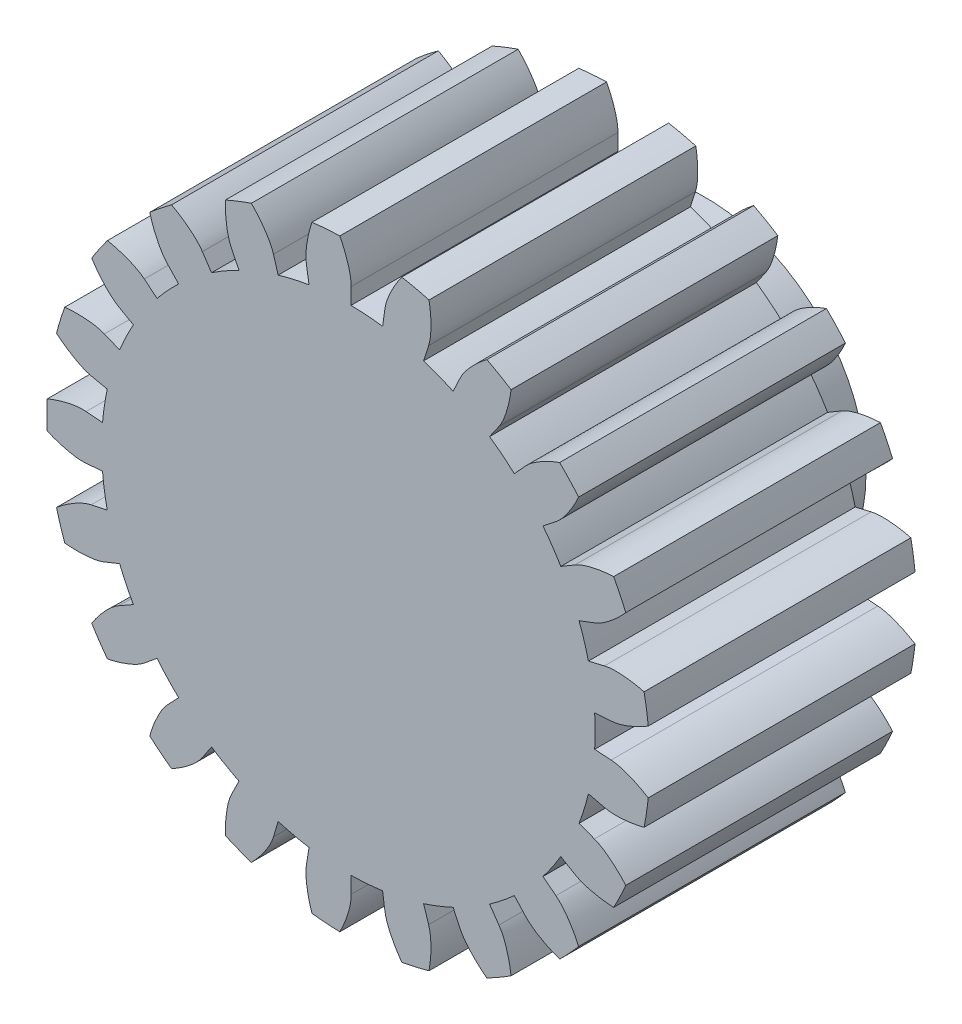
from build123d import *

# Parameters (mm, degrees)
SKETCH_1_R               = 5.75
SKETCH_1_R_2             = 1.475
EXTRUDE_1_DEPTH          = 5
CUT_EXTRUDE_1_DEPTH      = 10.545941546
PATTERN_CIRCULAR_1_DEPTH = 5
SKETCH_2_R               = 1.475
EXTRUDE_2_DEPTH          = 5
SKETCH_3_R               = 3
SKETCH_3_R_2             = 2
SKETCH_3_W               = 2
SKETCH_3_H               = 0.5
SKETCH_3_W_2             = 0.5
SKETCH_3_H_2             = 2
EXTRUDE_3_DEPTH          = 1.7
CUT_EXTRUDE_START        = -1
SKETCH_5_R               = 2
CUT_EXTRUDE_2_DEPTH      = 1
SKETCH_6_OUTSIDE_W       = 16.976
SKETCH_6_OUTSIDE_H       = 17.004
SKETCH_6_OUTSIDE_R       = 5.65
CUT_EXTRUDE_3_DEPTH      = 11.534196955


# Read off the part's stored shape, not the designer's step: 阵列(圆周)1
with BuildPart() as part:
    # 草图1 → 凸台-拉伸1 (new body)
    with BuildSketch(Plane.XY):
        Circle(SKETCH_1_R)
        Circle(SKETCH_1_R_2, mode=Mode.SUBTRACT)
    extrude(amount=EXTRUDE_1_DEPTH)

    # 草图1<3> → 切除-拉伸1 (cut, through all)
    with BuildSketch(Plane.XY):
        with BuildLine():
            Line((4.923195788, 0.316927775), (4.615446536, 0.297116602))
            ThreePointArc((4.615446536, 0.297116602), (4.622611017, 0.148635076), (4.625, 0))
            ThreePointArc((4.625, 0), (4.622611017, -0.148635076), (4.615446536, -0.297116602))
            Line((4.615446536, -0.297116602), (4.923195788, -0.316927775))
            add(Edge.make_bspline(
                [(4.923195788, -0.316927775), (4.960723978, -0.31934363), (5.064950694, -0.333885203), (5.258056408, -0.392528318), (5.454545861, -0.4832362), (5.608701438, -0.573335861), (5.701232058, -0.634072387), (5.713983029, -0.642571358)],
                knots=[0, 0, 0, 0, 0, 0.005604068, 0.015718248, 0.029959916, 0.032248441, 0.032248441, 0.032248441, 0.032248441, 0.032248441], degree=4))
            ThreePointArc((5.713983029, -0.642571358), (5.740988696, -0.321789983), (5.75, 0))
            ThreePointArc((5.75, 0), (5.740988696, 0.321789983), (5.713983029, 0.642571358))
            add(Edge.make_bspline(
                [(4.923195788, 0.316927775), (4.960723978, 0.31934363), (5.064950694, 0.333885203), (5.258056408, 0.392528318), (5.454545861, 0.4832362), (5.608701438, 0.573335861), (5.701232058, 0.634072387), (5.713983029, 0.642571358)],
                knots=[0, 0, 0, 0, 0, 0.005604068, 0.015718248, 0.029959916, 0.032248441, 0.032248441, 0.032248441, 0.032248441, 0.032248441], degree=4))
        make_face()
    extrude(amount=CUT_EXTRUDE_1_DEPTH, mode=Mode.SUBTRACT)

    # 阵列(圆周)1 outline → 阵列(圆周)1 (cut)
    with BuildSketch(Plane.XY):
        with BuildLine():
            Line((4.497971852, 1.076510204), (4.797888114, 1.14828987))
            add(Edge.make_bspline(
                [(4.797888114, 1.14828987), (4.834461118, 1.157042973), (4.938343537, 1.173868805), (5.140155468, 1.174749947), (5.354652063, 1.145988245), (5.528516281, 1.105329614), (5.634838431, 1.07456532), (5.649528027, 1.070202349)],
                knots=[0, 0, 0, 0, 0, 0.005604068, 0.015718248, 0.029959916, 0.032248441, 0.032248441, 0.032248441, 0.032248441, 0.032248441], degree=4))
            ThreePointArc((5.649528027, 1.070202349), (5.494543634, 1.694842253), (5.270725563, 2.298249779))
            add(Edge.make_bspline(
                [(4.611055911, 1.753984996), (4.646204743, 1.76735515), (4.741514754, 1.811972045), (4.908755962, 1.92492872), (5.069779322, 2.069522988), (5.190528858, 2.201057927), (5.261046198, 2.286369979), (5.270725563, 2.298249779)],
                knots=[0, 0, 0, 0, 0, 0.005604068, 0.015718248, 0.029959916, 0.032248441, 0.032248441, 0.032248441, 0.032248441, 0.032248441], degree=4))
            Line((4.611055911, 1.753984996), (4.32281854, 1.644343293))
            ThreePointArc((4.32281854, 1.644343293), (4.419524227, 1.363242682), (4.497971852, 1.076510204))
        make_face()
        with BuildLine():
            add(Edge.make_bspline(
                [(4.611055911, -1.753984996), (4.646204743, -1.76735515), (4.741514754, -1.811972045), (4.908755962, -1.92492872), (5.069779322, -2.069522988), (5.190528858, -2.201057927), (5.261046198, -2.286369979), (5.270725562, -2.298249779)],
                knots=[0, 0, 0, 0, 0, 0.005604068, 0.015718248, 0.029959916, 0.032248441, 0.032248441, 0.032248441, 0.032248441, 0.032248441], degree=4))
            ThreePointArc((5.270725562, -2.298249779), (5.494543634, -1.694842253), (5.649528028, -1.070202349))
            add(Edge.make_bspline(
                [(4.797888114, -1.14828987), (4.834461118, -1.157042973), (4.938343537, -1.173868805), (5.140155468, -1.174749947), (5.354652063, -1.145988245), (5.528516281, -1.105329614), (5.634838431, -1.07456532), (5.649528028, -1.070202349)],
                knots=[0, 0, 0, 0, 0, 0.005604068, 0.015718248, 0.029959916, 0.032248441, 0.032248441, 0.032248441, 0.032248441, 0.032248441], degree=4))
            Line((4.797888114, -1.14828987), (4.497971852, -1.076510204))
            ThreePointArc((4.497971852, -1.076510204), (4.419524227, -1.363242682), (4.32281854, -1.644343293))
            Line((4.32281854, -1.644343293), (4.611055911, -1.753984996))
        make_face()
        with BuildLine():
            add(Edge.make_bspline(
                [(3.889203481, -3.035192954), (3.918849827, -3.058329409), (3.996774421, -3.12905722), (4.123291007, -3.286290758), (4.234540642, -3.471923576), (4.311155011, -3.633206338), (4.353393294, -3.735513566), (4.359141, -3.749718622)],
                knots=[0, 0, 0, 0, 0, 0.005604068, 0.015718248, 0.029959916, 0.032248441, 0.032248441, 0.032248441, 0.032248441, 0.032248441], degree=4))
            ThreePointArc((4.359141, -3.749718622), (4.750872953, -3.239090334), (5.083087669, -2.687883881))
            add(Edge.make_bspline(
                [(4.246267026, -2.511476921), (4.278635171, -2.53062123), (4.372942885, -2.577319418), (4.565529157, -2.637646525), (4.77897393, -2.673386606), (4.957098192, -2.685781701), (5.067764682, -2.687723183), (5.083087669, -2.687883881)],
                knots=[0, 0, 0, 0, 0, 0.005604068, 0.015718248, 0.029959916, 0.032248441, 0.032248441, 0.032248441, 0.032248441, 0.032248441], degree=4))
            Line((4.246267026, -2.511476921), (3.98083263, -2.354484354))
            ThreePointArc((3.98083263, -2.354484354), (3.821354331, -2.605355269), (3.646089147, -2.845462867))
            Line((3.646089147, -2.845462867), (3.889203481, -3.035192954))
        make_face()
        with BuildLine():
            add(Edge.make_bspline(
                [(2.821778254, -4.046710697), (2.843287907, -4.077557678), (2.896903141, -4.168111928), (2.971453551, -4.35565144), (3.023044444, -4.565828519), (3.048716122, -4.742528422), (3.058922292, -4.852740379), (3.060227629, -4.86800851)],
                knots=[0, 0, 0, 0, 0, 0.005604068, 0.015718248, 0.029959916, 0.032248441, 0.032248441, 0.032248441, 0.032248441, 0.032248441], degree=4))
            ThreePointArc((3.060227629, -4.86800851), (3.585066361, -4.495531025), (4.064992664, -4.066735134))
            add(Edge.make_bspline(
                [(3.317346479, -3.651508226), (3.342633714, -3.679342685), (3.418987068, -3.75176389), (3.585235545, -3.866176633), (3.778662992, -3.963242834), (3.945220174, -4.027590298), (4.050397801, -4.062065045), (4.064992664, -4.066735134)],
                knots=[0, 0, 0, 0, 0, 0.005604068, 0.015718248, 0.029959916, 0.032248441, 0.032248441, 0.032248441, 0.032248441, 0.032248441], degree=4))
            Line((3.317346479, -3.651508226), (3.109978959, -3.423252236))
            ThreePointArc((3.109978959, -3.423252236), (2.883640334, -3.615970606), (2.645388733, -3.793750578))
            Line((2.645388733, -3.793750578), (2.821778254, -4.046710697))
        make_face()
        with BuildLine():
            add(Edge.make_bspline(
                [(1.503625646, -4.698660436), (1.515087378, -4.734477054), (1.539629304, -4.836811601), (1.555589407, -5.037993377), (1.54293748, -5.254039561), (1.515385427, -5.430456043), (1.492652621, -5.538779913), (1.489399604, -5.553754479)],
                knots=[0, 0, 0, 0, 0, 0.005604068, 0.015718248, 0.029959916, 0.032248441, 0.032248441, 0.032248441, 0.032248441, 0.032248441], degree=4))
            ThreePointArc((1.489399604, -5.553754479), (2.10071089, -5.352524055), (2.685705221, -5.084239124))
            add(Edge.make_bspline(
                [(2.093665138, -4.467087001), (2.109624581, -4.501138397), (2.161239245, -4.592847677), (2.286378021, -4.751179981), (2.442601265, -4.900947544), (2.58279203, -5.011529822), (2.6731353, -5.075474603), (2.685705221, -5.084239124)],
                knots=[0, 0, 0, 0, 0, 0.005604068, 0.015718248, 0.029959916, 0.032248441, 0.032248441, 0.032248441, 0.032248441, 0.032248441], degree=4))
            Line((2.093665138, -4.467087001), (1.96279001, -4.187849135))
            ThreePointArc((1.96279001, -4.187849135), (1.689702238, -4.305291087), (1.409633921, -4.404946902))
            Line((1.409633921, -4.404946902), (1.503625646, -4.698660436))
        make_face()
        with BuildLine():
            add(Edge.make_bspline(
                [(0.051869301, -4.933113576), (0.052264687, -4.970717367), (0.045552647, -5.075739337), (0.001504318, -5.272687494), (-0.074266251, -5.475406131), (-0.152593914, -5.635863813), (-0.206245786, -5.732674546), (-0.213768111, -5.746024991)],
                knots=[0, 0, 0, 0, 0, 0.005604068, 0.015718248, 0.029959916, 0.032248441, 0.032248441, 0.032248441, 0.032248441, 0.032248441], degree=4))
            ThreePointArc((-0.213768111, -5.746024991), (0.429698038, -5.733921834), (1.067781084, -5.649986156))
            add(Edge.make_bspline(
                [(0.683952463, -4.885745492), (0.689166047, -4.922988208), (0.711455832, -5.025836792), (0.784365777, -5.214020138), (0.889503696, -5.403181558), (0.990871481, -5.550172928), (1.058352997, -5.637905968), (1.067781084, -5.649986156)],
                knots=[0, 0, 0, 0, 0, 0.005604068, 0.015718248, 0.029959916, 0.032248441, 0.032248441, 0.032248441, 0.032248441, 0.032248441], degree=4))
            Line((0.683952463, -4.885745492), (0.641198555, -4.58033726))
            ThreePointArc((0.641198555, -4.58033726), (0.345626683, -4.612067562), (0.048626948, -4.624744363))
            Line((0.048626948, -4.624744363), (0.051869301, -4.933113576))
        make_face()
        with BuildLine():
            add(Edge.make_bspline(
                [(-1.404495859, -4.729237926), (-1.415201951, -4.765287628), (-1.452571563, -4.863665358), (-1.552714436, -5.038880188), (-1.684871098, -5.210258837), (-1.807014616, -5.340500352), (-1.886818351, -5.417195888), (-1.897941592, -5.427735966)],
                knots=[0, 0, 0, 0, 0, 0.005604068, 0.015718248, 0.029959916, 0.032248441, 0.032248441, 0.032248441, 0.032248441, 0.032248441], degree=4))
            ThreePointArc((-1.897941592, -5.427735966), (-1.27949537, -5.605835495), (-0.645020088, -5.713707123))
            add(Edge.make_bspline(
                [(-0.786532391, -4.870284055), (-0.792527914, -4.907408914), (-0.801543555, -5.012258252), (-0.787340809, -5.213571724), (-0.74263018, -5.425319178), (-0.689092349, -5.595658814), (-0.650468614, -5.699384647), (-0.645020088, -5.713707123)],
                knots=[0, 0, 0, 0, 0, 0.005604068, 0.015718248, 0.029959916, 0.032248441, 0.032248441, 0.032248441, 0.032248441, 0.032248441], degree=4))
            Line((-0.786532391, -4.870284055), (-0.737366206, -4.565842319))
            ThreePointArc((-0.737366206, -4.565842319), (-1.02915932, -4.509041594), (-1.316700742, -4.433612991))
            Line((-1.316700742, -4.433612991), (-1.404495859, -4.729237926))
        make_face()
        with BuildLine():
            add(Edge.make_bspline(
                [(-2.736065398, -4.105148733), (-2.756921685, -4.136441171), (-2.821628415, -4.219433368), (-2.968967699, -4.357346265), (-3.145767755, -4.482157182), (-3.300874139, -4.570609997), (-3.399738824, -4.620375602), (-3.413474634, -4.627168781)],
                knots=[0, 0, 0, 0, 0, 0.005604068, 0.015718248, 0.029959916, 0.032248441, 0.032248441, 0.032248441, 0.032248441, 0.032248441], degree=4))
            ThreePointArc((-3.413474634, -4.627168781), (-2.875, -4.979646072), (-2.300508395, -5.269740138))
            add(Edge.make_bspline(
                [(-2.18713039, -4.422076508), (-2.203802293, -4.455784801), (-2.243322279, -4.553318571), (-2.289088709, -4.749874583), (-2.308778105, -4.965393381), (-2.307827299, -5.143945858), (-2.301493234, -5.254447989), (-2.300508395, -5.269740138)],
                knots=[0, 0, 0, 0, 0, 0.005604068, 0.015718248, 0.029959916, 0.032248441, 0.032248441, 0.032248441, 0.032248441, 0.032248441], degree=4))
            Line((-2.18713039, -4.422076508), (-2.050412743, -4.145652251))
            ThreePointArc((-2.050412743, -4.145652251), (-2.3125, -4.005367493), (-2.565033793, -3.848535649))
            Line((-2.565033793, -3.848535649), (-2.736065398, -4.105148733))
        make_face()
        with BuildLine():
            add(Edge.make_bspline(
                [(-3.82452352, -3.116299059), (-3.853676829, -3.140053764), (-3.939971199, -3.200286207), (-4.121415153, -3.288643004), (-4.327149142, -3.355796191), (-4.501436509, -3.394600886), (-4.610577583, -3.413014668), (-4.625705474, -3.415457344)],
                knots=[0, 0, 0, 0, 0, 0.005604068, 0.015718248, 0.029959916, 0.032248441, 0.032248441, 0.032248441, 0.032248441, 0.032248441], degree=4))
            ThreePointArc((-4.625705474, -3.415457344), (-4.215048263, -3.910993242), (-3.751586435, -4.357533617))
            add(Edge.make_bspline(
                [(-3.393392255, -3.580948056), (-3.419259167, -3.608244655), (-3.485771974, -3.689796553), (-3.587441031, -3.864130241), (-3.669780964, -4.064270592), (-3.721501666, -4.235170738), (-3.748020081, -4.342630568), (-3.751586435, -4.357533617)],
                knots=[0, 0, 0, 0, 0, 0.005604068, 0.015718248, 0.029959916, 0.032248441, 0.032248441, 0.032248441, 0.032248441, 0.032248441], degree=4))
            Line((-3.393392255, -3.580948056), (-3.18127111, -3.357102787))
            ThreePointArc((-3.18127111, -3.357102787), (-3.390364907, -3.145798912), (-3.585452335, -2.921499025))
            Line((-3.585452335, -2.921499025), (-3.82452352, -3.116299059))
        make_face()
        with BuildLine():
            add(Edge.make_bspline(
                [(-4.573155944, -1.850552538), (-4.608015875, -1.8646588), (-4.708230253, -1.896779572), (-4.907656784, -1.92772938), (-5.124044338, -1.931257982), (-5.302026492, -1.91696659), (-5.411746291, -1.902392403), (-5.426922084, -1.900267533)],
                knots=[0, 0, 0, 0, 0, 0.005604068, 0.015718248, 0.029959916, 0.032248441, 0.032248441, 0.032248441, 0.032248441, 0.032248441], degree=4))
            ThreePointArc((-5.426922084, -1.900267533), (-5.18057099, -2.4948315), (-4.869319557, -3.05814111))
            add(Edge.make_bspline(
                [(-4.298136328, -2.421636656), (-4.330899858, -2.440096137), (-4.418495532, -2.498419919), (-4.567033475, -2.635040969), (-4.70470768, -2.802019525), (-4.804504278, -2.950082113), (-4.861518895, -3.044951364), (-4.869319557, -3.05814111)],
                knots=[0, 0, 0, 0, 0, 0.005604068, 0.015718248, 0.029959916, 0.032248441, 0.032248441, 0.032248441, 0.032248441, 0.032248441], degree=4))
            Line((-4.298136328, -2.421636656), (-4.029459578, -2.270260009))
            ThreePointArc((-4.029459578, -2.270260009), (-4.166981014, -2.006712294), (-4.287287702, -1.734874393))
            Line((-4.287287702, -1.734874393), (-4.573155944, -1.850552538))
        make_face()
        with BuildLine():
            add(Edge.make_bspline(
                [(-4.915443393, -0.420376303), (-4.952912488, -0.423580718), (-5.058142386, -0.424735748), (-5.257831572, -0.395528542), (-5.465645708, -0.335119025), (-5.631508153, -0.2690014), (-5.732057592, -0.222734224), (-5.74593285, -0.216230613)],
                knots=[0, 0, 0, 0, 0, 0.005604068, 0.015718248, 0.029959916, 0.032248441, 0.032248441, 0.032248441, 0.032248441, 0.032248441], degree=4))
            ThreePointArc((-5.74593285, -0.216230613), (-5.685777251, -0.856993031), (-5.554392268, -1.487019346))
            add(Edge.make_bspline(
                [(-4.820972125, -1.047152211), (-4.857721092, -1.055134369), (-4.958616372, -1.085047711), (-5.140824952, -1.171816744), (-5.321600472, -1.290796727), (-5.460605601, -1.402865745), (-5.543050421, -1.476714868), (-5.554392268, -1.487019346)],
                knots=[0, 0, 0, 0, 0, 0.005604068, 0.015718248, 0.029959916, 0.032248441, 0.032248441, 0.032248441, 0.032248441, 0.032248441], degree=4))
            Line((-4.820972125, -1.047152211), (-4.51961288, -0.981694666))
            ThreePointArc((-4.51961288, -0.981694666), (-4.573342571, -0.689320481), (-4.608178743, -0.394098556))
            Line((-4.608178743, -0.394098556), (-4.915443393, -0.420376303))
        make_face()
        with BuildLine():
            add(Edge.make_bspline(
                [(-4.820972125, 1.047152211), (-4.857721092, 1.055134369), (-4.958616372, 1.085047711), (-5.140824952, 1.171816744), (-5.321600472, 1.290796727), (-5.460605601, 1.402865745), (-5.543050421, 1.476714868), (-5.554392268, 1.487019346)],
                knots=[0, 0, 0, 0, 0, 0.005604068, 0.015718248, 0.029959916, 0.032248441, 0.032248441, 0.032248441, 0.032248441, 0.032248441], degree=4))
            ThreePointArc((-5.554392268, 1.487019346), (-5.685777251, 0.856993031), (-5.74593285, 0.216230613))
            add(Edge.make_bspline(
                [(-4.915443393, 0.420376303), (-4.952912488, 0.423580718), (-5.058142386, 0.424735748), (-5.257831572, 0.395528542), (-5.465645708, 0.335119025), (-5.631508153, 0.2690014), (-5.732057592, 0.222734224), (-5.74593285, 0.216230613)],
                knots=[0, 0, 0, 0, 0, 0.005604068, 0.015718248, 0.029959916, 0.032248441, 0.032248441, 0.032248441, 0.032248441, 0.032248441], degree=4))
            Line((-4.915443393, 0.420376303), (-4.608178743, 0.394098556))
            ThreePointArc((-4.608178743, 0.394098556), (-4.573342571, 0.689320481), (-4.51961288, 0.981694666))
            Line((-4.51961288, 0.981694666), (-4.820972125, 1.047152211))
        make_face()
        with BuildLine():
            add(Edge.make_bspline(
                [(-4.298136328, 2.421636656), (-4.330899858, 2.440096137), (-4.418495532, 2.498419919), (-4.567033475, 2.635040969), (-4.70470768, 2.802019525), (-4.804504278, 2.950082113), (-4.861518895, 3.044951364), (-4.869319557, 3.05814111)],
                knots=[0, 0, 0, 0, 0, 0.005604068, 0.015718248, 0.029959916, 0.032248441, 0.032248441, 0.032248441, 0.032248441, 0.032248441], degree=4))
            ThreePointArc((-4.869319557, 3.05814111), (-5.18057099, 2.4948315), (-5.426922084, 1.900267533))
            add(Edge.make_bspline(
                [(-4.573155944, 1.850552538), (-4.608015875, 1.8646588), (-4.708230253, 1.896779572), (-4.907656784, 1.92772938), (-5.124044338, 1.931257982), (-5.302026492, 1.91696659), (-5.411746291, 1.902392403), (-5.426922084, 1.900267533)],
                knots=[0, 0, 0, 0, 0, 0.005604068, 0.015718248, 0.029959916, 0.032248441, 0.032248441, 0.032248441, 0.032248441, 0.032248441], degree=4))
            Line((-4.573155944, 1.850552538), (-4.287287702, 1.734874393))
            ThreePointArc((-4.287287702, 1.734874393), (-4.166981014, 2.006712294), (-4.029459578, 2.270260009))
            Line((-4.029459578, 2.270260009), (-4.298136328, 2.421636656))
        make_face()
        with BuildLine():
            add(Edge.make_bspline(
                [(-3.393392255, 3.580948056), (-3.419259167, 3.608244655), (-3.485771974, 3.689796553), (-3.587441031, 3.864130241), (-3.669780964, 4.064270592), (-3.721501666, 4.235170738), (-3.748020081, 4.342630568), (-3.751586435, 4.357533617)],
                knots=[0, 0, 0, 0, 0, 0.005604068, 0.015718248, 0.029959916, 0.032248441, 0.032248441, 0.032248441, 0.032248441, 0.032248441], degree=4))
            ThreePointArc((-3.751586435, 4.357533617), (-4.215048263, 3.910993242), (-4.625705474, 3.415457344))
            add(Edge.make_bspline(
                [(-3.82452352, 3.116299059), (-3.853676829, 3.140053764), (-3.939971199, 3.200286207), (-4.121415153, 3.288643004), (-4.327149142, 3.355796191), (-4.501436509, 3.394600886), (-4.610577583, 3.413014668), (-4.625705474, 3.415457344)],
                knots=[0, 0, 0, 0, 0, 0.005604068, 0.015718248, 0.029959916, 0.032248441, 0.032248441, 0.032248441, 0.032248441, 0.032248441], degree=4))
            Line((-3.82452352, 3.116299059), (-3.585452335, 2.921499025))
            ThreePointArc((-3.585452335, 2.921499025), (-3.390364907, 3.145798912), (-3.18127111, 3.357102787))
            Line((-3.18127111, 3.357102787), (-3.393392255, 3.580948056))
        make_face()
        with BuildLine():
            add(Edge.make_bspline(
                [(-2.18713039, 4.422076508), (-2.203802293, 4.455784801), (-2.243322279, 4.553318571), (-2.289088709, 4.749874583), (-2.308778105, 4.965393381), (-2.307827299, 5.143945858), (-2.301493234, 5.254447989), (-2.300508395, 5.269740138)],
                knots=[0, 0, 0, 0, 0, 0.005604068, 0.015718248, 0.029959916, 0.032248441, 0.032248441, 0.032248441, 0.032248441, 0.032248441], degree=4))
            ThreePointArc((-2.300508395, 5.269740138), (-2.875, 4.979646072), (-3.413474634, 4.627168781))
            add(Edge.make_bspline(
                [(-2.736065398, 4.105148733), (-2.756921685, 4.136441171), (-2.821628415, 4.219433368), (-2.968967699, 4.357346265), (-3.145767755, 4.482157182), (-3.300874139, 4.570609997), (-3.399738824, 4.620375602), (-3.413474634, 4.627168781)],
                knots=[0, 0, 0, 0, 0, 0.005604068, 0.015718248, 0.029959916, 0.032248441, 0.032248441, 0.032248441, 0.032248441, 0.032248441], degree=4))
            Line((-2.736065398, 4.105148733), (-2.565033793, 3.848535649))
            ThreePointArc((-2.565033793, 3.848535649), (-2.3125, 4.005367493), (-2.050412743, 4.145652251))
            Line((-2.050412743, 4.145652251), (-2.18713039, 4.422076508))
        make_face()
        with BuildLine():
            add(Edge.make_bspline(
                [(-0.786532391, 4.870284055), (-0.792527914, 4.907408914), (-0.801543555, 5.012258252), (-0.787340809, 5.213571724), (-0.74263018, 5.425319178), (-0.689092349, 5.595658814), (-0.650468614, 5.699384647), (-0.645020088, 5.713707123)],
                knots=[0, 0, 0, 0, 0, 0.005604068, 0.015718248, 0.029959916, 0.032248441, 0.032248441, 0.032248441, 0.032248441, 0.032248441], degree=4))
            ThreePointArc((-0.645020088, 5.713707123), (-1.27949537, 5.605835495), (-1.897941592, 5.427735966))
            add(Edge.make_bspline(
                [(-1.404495859, 4.729237926), (-1.415201951, 4.765287628), (-1.452571563, 4.863665358), (-1.552714436, 5.038880188), (-1.684871098, 5.210258837), (-1.807014616, 5.340500352), (-1.886818351, 5.417195888), (-1.897941592, 5.427735966)],
                knots=[0, 0, 0, 0, 0, 0.005604068, 0.015718248, 0.029959916, 0.032248441, 0.032248441, 0.032248441, 0.032248441, 0.032248441], degree=4))
            Line((-1.404495859, 4.729237926), (-1.316700742, 4.433612991))
            ThreePointArc((-1.316700742, 4.433612991), (-1.02915932, 4.509041594), (-0.737366206, 4.565842319))
            Line((-0.737366206, 4.565842319), (-0.786532391, 4.870284055))
        make_face()
        with BuildLine():
            add(Edge.make_bspline(
                [(0.683952463, 4.885745492), (0.689166047, 4.922988208), (0.711455832, 5.025836792), (0.784365777, 5.214020138), (0.889503696, 5.403181558), (0.990871481, 5.550172928), (1.058352997, 5.637905968), (1.067781084, 5.649986155)],
                knots=[0, 0, 0, 0, 0, 0.005604068, 0.015718248, 0.029959916, 0.032248441, 0.032248441, 0.032248441, 0.032248441, 0.032248441], degree=4))
            ThreePointArc((1.067781084, 5.649986155), (0.429698038, 5.733921834), (-0.213768111, 5.746024991))
            add(Edge.make_bspline(
                [(0.051869301, 4.933113576), (0.052264687, 4.970717367), (0.045552647, 5.075739337), (0.001504318, 5.272687494), (-0.074266251, 5.475406131), (-0.152593914, 5.635863813), (-0.206245786, 5.732674546), (-0.213768111, 5.746024991)],
                knots=[0, 0, 0, 0, 0, 0.005604068, 0.015718248, 0.029959916, 0.032248441, 0.032248441, 0.032248441, 0.032248441, 0.032248441], degree=4))
            Line((0.051869301, 4.933113576), (0.048626948, 4.624744363))
            ThreePointArc((0.048626948, 4.624744363), (0.345626683, 4.612067562), (0.641198555, 4.58033726))
            Line((0.641198555, 4.58033726), (0.683952463, 4.885745492))
        make_face()
        with BuildLine():
            add(Edge.make_bspline(
                [(2.093665138, 4.467087001), (2.109624581, 4.501138397), (2.161239245, 4.592847677), (2.286378021, 4.751179981), (2.442601265, 4.900947544), (2.58279203, 5.011529822), (2.6731353, 5.075474603), (2.685705221, 5.084239123)],
                knots=[0, 0, 0, 0, 0, 0.005604068, 0.015718248, 0.029959916, 0.032248441, 0.032248441, 0.032248441, 0.032248441, 0.032248441], degree=4))
            ThreePointArc((2.685705221, 5.084239123), (2.10071089, 5.352524055), (1.489399605, 5.55375448))
            add(Edge.make_bspline(
                [(1.503625646, 4.698660436), (1.515087378, 4.734477054), (1.539629304, 4.836811601), (1.555589407, 5.037993377), (1.54293748, 5.254039561), (1.515385427, 5.430456043), (1.492652621, 5.538779913), (1.489399605, 5.55375448)],
                knots=[0, 0, 0, 0, 0, 0.005604068, 0.015718248, 0.029959916, 0.032248441, 0.032248441, 0.032248441, 0.032248441, 0.032248441], degree=4))
            Line((1.503625646, 4.698660436), (1.409633921, 4.404946902))
            ThreePointArc((1.409633921, 4.404946902), (1.689702238, 4.305291087), (1.96279001, 4.187849135))
            Line((1.96279001, 4.187849135), (2.093665138, 4.467087001))
        make_face()
        with BuildLine():
            add(Edge.make_bspline(
                [(3.317346479, 3.651508226), (3.342633714, 3.679342685), (3.418987068, 3.75176389), (3.585235545, 3.866176633), (3.778662992, 3.963242834), (3.945220174, 4.027590298), (4.050397801, 4.062065045), (4.064992663, 4.066735134)],
                knots=[0, 0, 0, 0, 0, 0.005604068, 0.015718248, 0.029959916, 0.032248441, 0.032248441, 0.032248441, 0.032248441, 0.032248441], degree=4))
            ThreePointArc((4.064992663, 4.066735134), (3.585066361, 4.495531025), (3.060227629, 4.868008511))
            add(Edge.make_bspline(
                [(2.821778254, 4.046710697), (2.843287907, 4.077557678), (2.896903141, 4.168111928), (2.971453551, 4.35565144), (3.023044444, 4.565828519), (3.048716122, 4.742528422), (3.058922292, 4.852740379), (3.060227629, 4.868008511)],
                knots=[0, 0, 0, 0, 0, 0.005604068, 0.015718248, 0.029959916, 0.032248441, 0.032248441, 0.032248441, 0.032248441, 0.032248441], degree=4))
            Line((2.821778254, 4.046710697), (2.645388733, 3.793750578))
            ThreePointArc((2.645388733, 3.793750578), (2.883640334, 3.615970606), (3.109978959, 3.423252236))
            Line((3.109978959, 3.423252236), (3.317346479, 3.651508226))
        make_face()
        with BuildLine():
            add(Edge.make_bspline(
                [(4.246267026, 2.511476921), (4.278635171, 2.53062123), (4.372942885, 2.577319418), (4.565529157, 2.637646525), (4.77897393, 2.673386606), (4.957098192, 2.685781701), (5.067764682, 2.687723183), (5.083087668, 2.687883881)],
                knots=[0, 0, 0, 0, 0, 0.005604068, 0.015718248, 0.029959916, 0.032248441, 0.032248441, 0.032248441, 0.032248441, 0.032248441], degree=4))
            ThreePointArc((5.083087668, 2.687883881), (4.750872953, 3.239090334), (4.359141, 3.749718623))
            add(Edge.make_bspline(
                [(3.889203481, 3.035192954), (3.918849827, 3.058329409), (3.996774421, 3.12905722), (4.123291007, 3.286290758), (4.234540642, 3.471923576), (4.311155011, 3.633206338), (4.353393294, 3.735513566), (4.359141, 3.749718623)],
                knots=[0, 0, 0, 0, 0, 0.005604068, 0.015718248, 0.029959916, 0.032248441, 0.032248441, 0.032248441, 0.032248441, 0.032248441], degree=4))
            Line((3.889203481, 3.035192954), (3.646089147, 2.845462867))
            ThreePointArc((3.646089147, 2.845462867), (3.821354331, 2.605355269), (3.98083263, 2.354484354))
            Line((3.98083263, 2.354484354), (4.246267026, 2.511476921))
        make_face()
    extrude(amount=PATTERN_CIRCULAR_1_DEPTH, mode=Mode.SUBTRACT)

    # 草图2 → 凸台-拉伸2 (add, through all)
    with BuildSketch(Plane.XY.offset(5)):
        Circle(SKETCH_2_R)
    extrude(amount=-EXTRUDE_2_DEPTH)

    # 草图3 → 凸台-拉伸3 (add)
    # profile 1 of 3: a face of its own
    with BuildSketch(Plane(origin=(0, 0, 0), x_dir=(-1, 0, 0), z_dir=(0, 0, -1))):
        with Locations(Location((0, 0, 0), (0, 0, 180))):
            Circle(SKETCH_3_R)
        Circle(SKETCH_3_R_2, mode=Mode.SUBTRACT)
    # profile 2 of 3: a face of its own
    with BuildSketch(Plane(origin=(0, 0, 0), x_dir=(-1, 0, 0), z_dir=(0, 0, -1))):
        Rectangle(SKETCH_3_W, SKETCH_3_H)
    # profile 3 of 3: a face of its own
    with BuildSketch(Plane(origin=(0, 0, 0), x_dir=(-1, 0, 0), z_dir=(0, 0, -1))):
        Rectangle(SKETCH_3_W_2, SKETCH_3_H_2)
    extrude(amount=EXTRUDE_3_DEPTH)

    # 草图5 → 切除-拉伸2 (cut)
    with BuildSketch(Plane(origin=(0, 0, -1.7), x_dir=(-1, 0, 0), z_dir=(0, 0, -1)).offset(CUT_EXTRUDE_START)):
        Circle(SKETCH_5_R)
    extrude(amount=CUT_EXTRUDE_2_DEPTH, mode=Mode.SUBTRACT)

    # 草图6 outside → 切除-拉伸3 (cut, through all)
    with BuildSketch(Plane.XY.offset(5)):
        with Locations((-0.018, 0)):
            Rectangle(SKETCH_6_OUTSIDE_W, SKETCH_6_OUTSIDE_H)
        Circle(SKETCH_6_OUTSIDE_R, mode=Mode.SUBTRACT)
    extrude(amount=-CUT_EXTRUDE_3_DEPTH, mode=Mode.SUBTRACT)


solid = part.part
